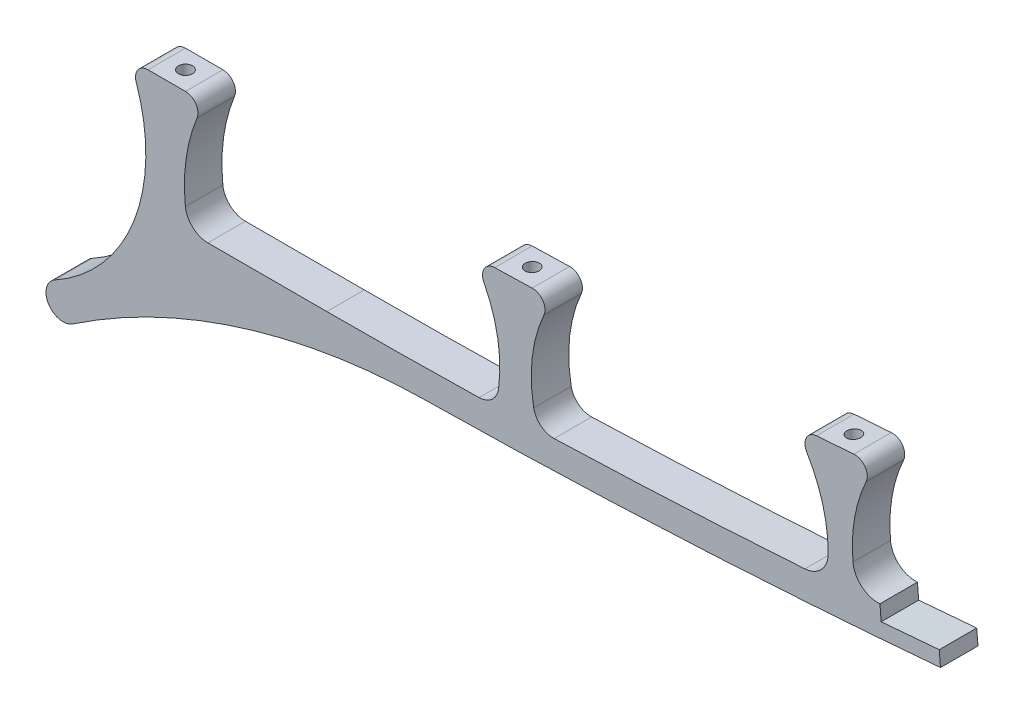
from build123d import *

# Parameters (mm, degrees)
BOSS_EXTRUDE5_DEPTH      = 4.7625
SKETCH6_R                = 1.778
CUT_EXTRUDE3_DEPTH       = 504.733086563
CUT_EXTRUDE4_START       = 3.556
SKETCH7_R                = 3.048
SKETCH7_R_2              = 1.778
CUT_EXTRUDE4_DEPTH       = 505.502600354
CUT_EXTRUDE5_DEPTH       = 506.075936751
SKETCH10_R               = 1.778
CUT_EXTRUDE6_DEPTH       = 502.305599398
CUT_EXTRUDE11_DEPTH      = 3.556
CUT_EXTRUDE11_DEPTH_BACK = 498.926861427
SKETCH12_R               = 3.048
SKETCH13_R               = 1.778
CUT_EXTRUDE12_DEPTH      = 500.236768439
CUT_EXTRUDE13_DEPTH      = 3.556
CUT_EXTRUDE13_DEPTH_BACK = 497.703321125
SKETCH14_R               = 3.048


with BuildPart() as part:
    # Sketch1 → Boss-Extrude5 (new, symmetric)
    with BuildSketch(Plane(origin=(0, 0, 4.097149242), x_dir=(-1, 0, 0), z_dir=(0, 0, -1))):
        with BuildLine():
            Line((4.980483945, -43.087244707), (5.013364858, -50.687454907))
            add(Edge.make_bspline(
                [(266.801551376, -61.551589611), (261.350884009, -61.078554924), (250.433518448, -60.153958667), (228.701217873, -58.434486699), (190.548987698, -55.763104255), (136.042529388, -52.86929541), (81.4824687, -51.236835025), (43.240954482, -50.737883821), (21.43842692, -50.650632415), (10.483916541, -50.667450636), (5.013364858, -50.687454907)],
                knots=[4.0417e-05, 4.0417e-05, 4.0417e-05, 4.0417e-05, 0.062531963, 0.125023508, 0.2500066, 0.499972783, 0.749938966, 0.874922057, 0.937413603, 0.999905149, 0.999905149, 0.999905149, 0.999905149], degree=3))
            add(Edge.make_bspline(
                [(398.35171036, -68.196818162), (396.265786035, -68.16801087), (352.35609282, -67.485074441), (308.459309619, -65.190615284), (266.801551376, -61.551589611)],
                knots=[0.388247103, 0.388247103, 0.388247103, 0.388247103, 0.401472843, 0.666666775, 0.666666775, 0.666666775, 0.666666775], degree=3))
            ThreePointArc((398.35171036, -68.196818162), (445.202941045, -75.692238551), (487.961522574, -96.257326662))
            ThreePointArc((487.961522574, -96.257326662), (494.102034598, -94.922101367), (492.499924864, -88.845757162))
            ThreePointArc((492.499924864, -88.845757162), (472.347982204, -65.669309605), (471.824439099, -34.961421092))
            ThreePointArc((471.824439099, -34.961421092), (471.408544547, -32.082865726), (468.823110549, -30.750731982))
            Line((468.823110549, -30.750731982), (464.060610549, -30.750731982))
            Line((464.060610549, -30.750731982), (459.298110549, -30.750731982))
            ThreePointArc((459.298110549, -30.750731982), (456.664489609, -32.15241144), (456.356218194, -35.119840174))
            ThreePointArc((456.356218194, -35.119840174), (459.13228847, -45.417631786), (459.332762362, -56.081162557))
            ThreePointArc((459.332762362, -56.081162557), (457.466080253, -59.753283819), (453.620807365, -61.230731982))
            Line((453.620807365, -61.230731985), (423.379813153, -61.230732209))
            add(Edge.make_bspline(
                [(384.69669435, -60.817291115), (385.490946639, -60.834366328), (398.38358415, -61.102948795), (411.282715888, -61.232192999), (423.379813153, -61.230732209)],
                knots=[0.584578013, 0.584578013, 0.584578013, 0.584578013, 0.589634714, 0.666658831, 0.666658831, 0.666658831, 0.666658831], degree=3))
            ThreePointArc((384.69669435, -60.817291115), (381.405012075, -59.519394431), (379.749008052, -56.392517605))
            ThreePointArc((379.749008052, -56.392517605), (379.962938882, -45.344267983), (383.481055682, -34.868942675))
            ThreePointArc((383.481055682, -34.868942675), (383.390574332, -31.793909155), (380.736068027, -30.23904122))
            add(Edge.make_bspline(
                [(380.736068027, -30.23904122), (377.567706075, -30.162607104), (374.399550345, -30.077611409), (371.231646974, -29.984054972)],
                knots=[0.564351213, 0.564351213, 0.564351213, 0.564351213, 0.584873669, 0.584873669, 0.584873669, 0.584873669], degree=3))
            ThreePointArc((371.231646974, -29.984054972), (368.497589908, -31.394357521), (368.242362423, -34.460116848))
            ThreePointArc((368.242362423, -34.460116848), (371.193755284, -45.109007001), (370.814996242, -56.152834368))
            ThreePointArc((370.814996242, -56.152834368), (368.993717842, -59.186422224), (365.637179655, -60.305958598))
            add(Edge.make_bspline(
                [(301.916083239, -57.118764264), (304.793492849, -57.314159562), (316.447125042, -58.077219349), (336.889920622, -59.214945623), (355.259103098, -59.96581465), (364.843153628, -60.280423029), (365.637179655, -60.305958598)],
                knots=[0.408750601, 0.408750601, 0.408750601, 0.408750601, 0.427107919, 0.483087827, 0.539067736, 0.544124431, 0.544124431, 0.544124431, 0.544124431], degree=3))
            ThreePointArc((301.916083239, -57.118764264), (297.703900514, -55.115863145), (295.996304567, -50.7755622))
            ThreePointArc((295.996304567, -50.7755622), (297.395526272, -40.599539879), (301.466201974, -31.168800195))
            ThreePointArc((301.466201974, -31.168800195), (301.565948035, -28.066269557), (298.971867926, -26.361454603))
            add(Edge.make_bspline(
                [(289.489598636, -25.664595471), (292.649719638, -25.90542225), (295.810491414, -26.137709697), (298.971867926, -26.361454603)],
                knots=[0.377389823, 0.377389823, 0.377389823, 0.377389823, 0.397912285, 0.397912285, 0.397912285, 0.397912285], degree=3))
            ThreePointArc((289.489598636, -25.664595471), (286.640803233, -27.018955044), (286.365734252, -30.161288915))
            ThreePointArc((286.365734252, -30.161288915), (289.309950073, -39.618561113), (289.709550194, -49.515465879))
            ThreePointArc((289.709550194, -49.515465879), (287.468803622, -53.805389908), (282.855937937, -55.270266537))
            Line((282.855937937, -55.270266537), (268.113256948, -54.036580381))
            add(Edge.make_bspline(
                [(268.113256948, -54.036580381), (262.634745624, -53.56111419), (251.663313863, -52.628696852), (229.81175043, -50.89541865), (191.471827261, -48.203857237), (136.679597141, -45.286916485), (81.835702382, -43.641470214), (43.402846546, -43.138474088), (21.480818831, -43.050269737), (10.476996172, -43.067138198), (4.980483945, -43.087244707)],
                knots=[-0.002434158, -0.002434158, -0.002434158, -0.002434158, 0.060213256, 0.12286067, 0.248155497, 0.498745152, 0.749334808, 0.874629635, 0.937277049, 0.999924463, 0.999924463, 0.999924463, 0.999924463], degree=3))
        make_face()
    boss_extrude5 = extrude(amount=BOSS_EXTRUDE5_DEPTH, both=True)

    # Sketch6 → Cut-Extrude3 (cut, through all)
    with BuildSketch(Plane(origin=(0.32087569, -4.366204823, 0), x_dir=(0.9973104440526221, 0.07329309778936742, 0), z_dir=(-0.07329309778936742, 0.9973104440526221, 0))):
        with Locations((-295.34595845, -4.097149242)):
            Circle(SKETCH6_R)
    cut_extrude3 = extrude(amount=-CUT_EXTRUDE3_DEPTH, mode=Mode.SUBTRACT)

    # Sketch7 → Cut-Extrude4 (cut)
    with BuildSketch(Plane(origin=(3.065947832, -41.718823267, 0), x_dir=(-0.9946544730103679, -0.07309790847145088, 0.07293267510222654), z_dir=(-0.07329309778936742, 0.9973104440526221, 0)).offset(CUT_EXTRUDE4_START)):
        with Locations((294.858228733, -17.454132845)):
            Circle(SKETCH7_R)
        with Locations((294.858228733, -17.454132845)):
            Circle(SKETCH7_R_2, mode=Mode.SUBTRACT)
    cut_extrude4 = extrude(amount=-CUT_EXTRUDE4_DEPTH, mode=Mode.SUBTRACT)

    # Mirror4: Boss-Extrude5, Cut-Extrude3, Cut-Extrude4 across plane
    add(boss_extrude5.mirror(Plane(origin=(-4.793985166, 0.020740296, 8.859649242), x_dir=(0, 0, 1), z_dir=(-0.9999906416249494, 0.004326275825933448, 0))))
    add(cut_extrude3.mirror(Plane(origin=(-4.793985166, 0.020740296, 8.859649242), x_dir=(0, 0, 1), z_dir=(-0.9999906416249494, 0.004326275825933448, 0))), mode=Mode.SUBTRACT)
    add(cut_extrude4.mirror(Plane(origin=(-4.793985166, 0.020740296, 8.859649242), x_dir=(0, 0, 1), z_dir=(-0.9999906416249494, 0.004326275825933448, 0))), mode=Mode.SUBTRACT)

    # Sketch9 → Cut-Extrude5 (cut, through all)
    with BuildSketch(Plane(origin=(0, 0, -0.665350758), x_dir=(-1, 0, 0), z_dir=(0, 0, -1))):
        Polygon((282.855937937, -55.270266537), (268.113256948, -54.036580381), (271.226711866, -16.830462442), (-501.730233012, -16.830462442), (-501.730233012, -147.179806135), (267.467078991, -61.609602167), (267.795541806, -57.83331017), (282.538222795, -59.066996326), align=None)
    extrude(amount=-CUT_EXTRUDE5_DEPTH, mode=Mode.SUBTRACT)

    # Sketch10 → Cut-Extrude6 (cut, through all)
    with BuildSketch(Plane(origin=(0.536837032, -20.010173799, 0), x_dir=(0.999640317874878, 0.026818554752505906, 0), z_dir=(-0.026818554752505906, 0.999640317874878, 0))):
        with Locations((-376.656171029, -4.097149242)):
            Circle(SKETCH10_R)
    extrude(amount=-CUT_EXTRUDE6_DEPTH, mode=Mode.SUBTRACT)

    # Sketch12 → Cut-Extrude11 (cut, two sides: drawn at the far end of the back side and taken through both)
    with BuildSketch(Plane(origin=(1.545827279, -57.619483473, 0), x_dir=(0.999640317874878, 0.02681855475250591, 0), z_dir=(-0.02681855475250591, 0.999640317874878, 0)).offset(-CUT_EXTRUDE11_DEPTH_BACK)):
        with Locations((-376.656171029, -4.097149242)):
            Circle(SKETCH12_R)
    extrude(amount=CUT_EXTRUDE11_DEPTH + CUT_EXTRUDE11_DEPTH_BACK, mode=Mode.SUBTRACT)

    # Sketch13 → Cut-Extrude12 (cut, through all)
    with BuildSketch(Plane(origin=(0, -30.750731982, 0), x_dir=(1, 0, 0), z_dir=(0, 1, 0))):
        with Locations((-464.060610549, -4.097149242)):
            Circle(SKETCH13_R)
    extrude(amount=-CUT_EXTRUDE12_DEPTH, mode=Mode.SUBTRACT)

    # Sketch14 → Cut-Extrude13 (cut, two sides: drawn at the far end of the back side and taken through both)
    with BuildSketch(Plane(origin=(0, -68.850731982, 0), x_dir=(1, 0, 0), z_dir=(0, 1, 0)).offset(-CUT_EXTRUDE13_DEPTH_BACK)):
        with Locations((-464.060610549, -4.097149242)):
            Circle(SKETCH14_R)
    extrude(amount=CUT_EXTRUDE13_DEPTH + CUT_EXTRUDE13_DEPTH_BACK, mode=Mode.SUBTRACT)


solid = part.part
